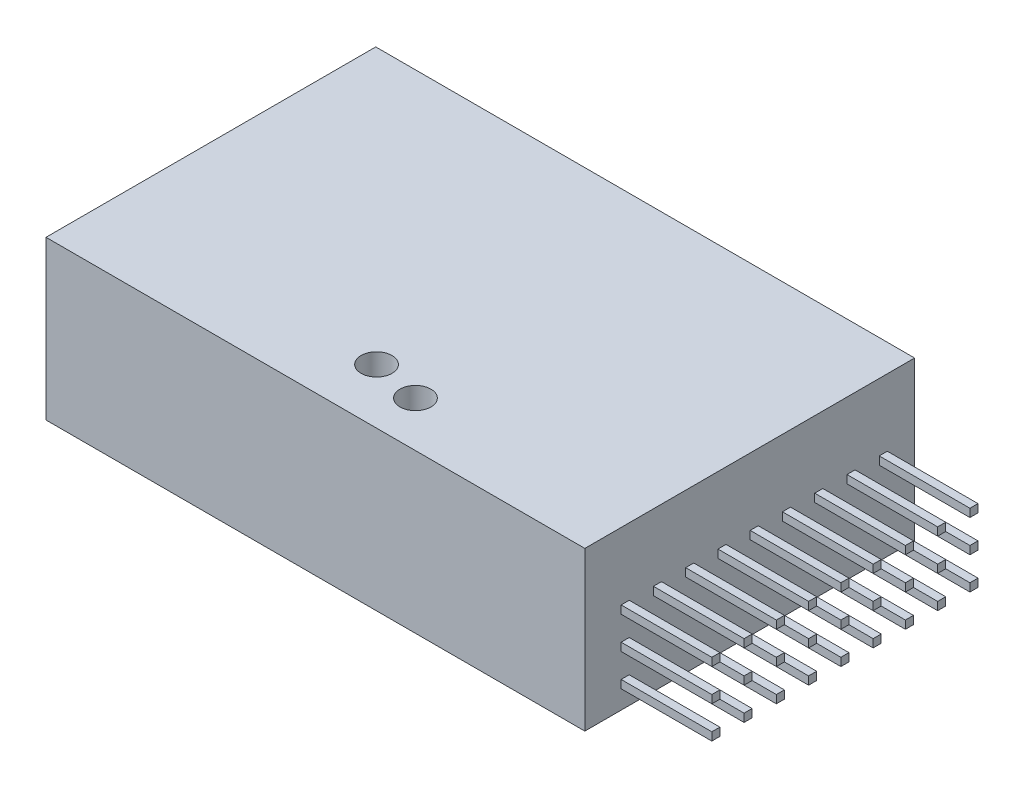
from build123d import *

# Parameters (mm, degrees)
SKETCH1_W          = 42.418
SKETCH1_H          = 25.9588
CASING_DEPTH       = 12.4587
SKETCH2_W          = 0.635
SKETCH2_H          = 0.635
PINS_DEPTH         = 7.1374
PINS_PATTERN_COUNT = 9
PINS_PATTERN_PITCH = 2.54
SKETCH3_R          = 1.2192
LED_DEPTH          = 5.0673
SKETCH4_R          = 1.2192
SCAN_BUTTON_DEPTH  = 3.6195


with BuildPart() as part:
    # Sketch1 → Casing (new body)
    with BuildSketch(Plane(origin=(0, 0, 0), x_dir=(1, 0, 0), z_dir=(0, 1, 0))):
        with Locations((21.209, 12.9794)):
            Rectangle(SKETCH1_W, SKETCH1_H)
    extrude(amount=CASING_DEPTH)

    # Sketch2 → Pins (add)
    with BuildSketch(Plane(origin=(42.418, 0, 0), x_dir=(0, 0, -1), z_dir=(1, 0, 0))):
        with Locations((23.495, 6.858)):
            Rectangle(SKETCH2_W, SKETCH2_H)
        with Locations((23.495, 4.318)):
            Rectangle(SKETCH2_W, SKETCH2_H)
        with Locations((23.495, 1.778)):
            Rectangle(SKETCH2_W, SKETCH2_H)
    pins = extrude(amount=PINS_DEPTH)

    # Pins pattern: Pins ×9
    with Locations(*[(0, 0, i * PINS_PATTERN_PITCH) for i in range(1, PINS_PATTERN_COUNT)]):
        add(pins)

    # Sketch3 → LED (cut)
    with BuildSketch(Plane(origin=(0, 12.4587, 0), x_dir=(1, 0, 0), z_dir=(0, 1, 0))):
        with Locations((25.5016, 3.5814)):
            Circle(SKETCH3_R)
    extrude(amount=-LED_DEPTH, mode=Mode.SUBTRACT)

    # Sketch4 → Scan button (cut)
    with BuildSketch(Plane(origin=(0, 12.4587, 0), x_dir=(1, 0, 0), z_dir=(0, 1, 0))):
        with Locations((21.6789, 4.3434)):
            Circle(SKETCH4_R)
    extrude(amount=-SCAN_BUTTON_DEPTH, mode=Mode.SUBTRACT)


solid = part.part
